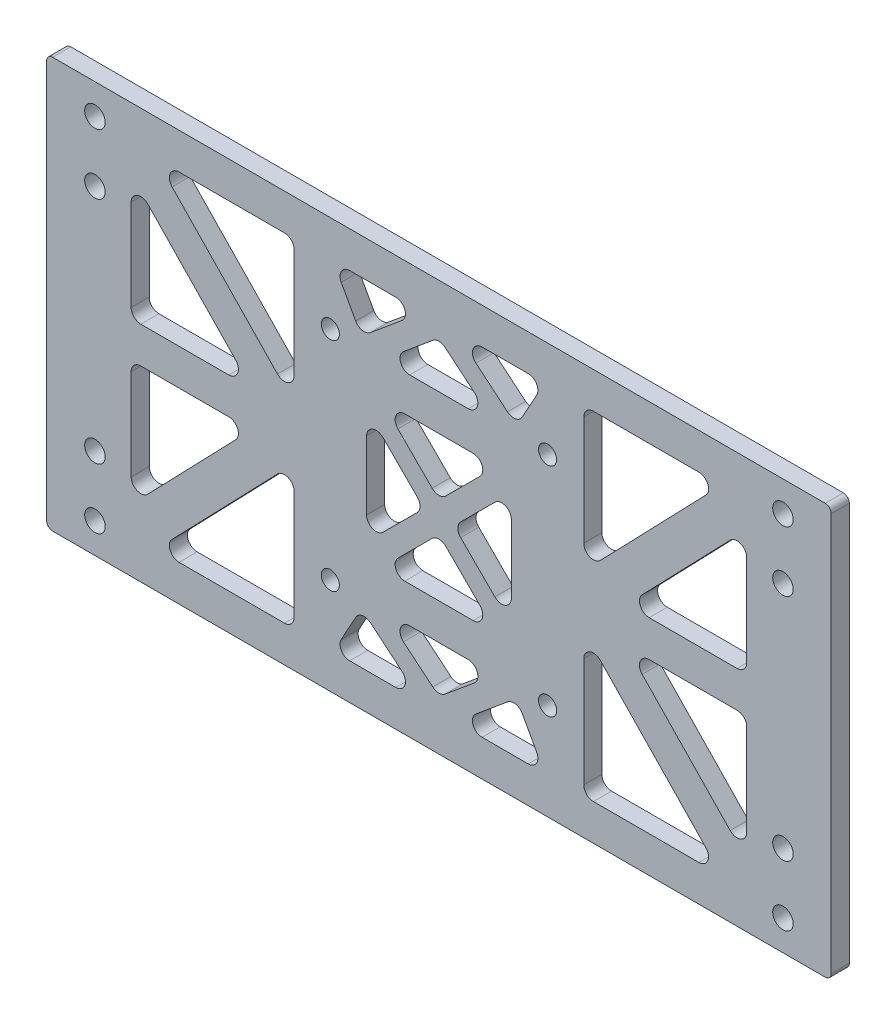
from build123d import *

# Parameters (mm, degrees)
SKETCH_1_W          = 130
SKETCH_1_H          = 68
EXTRUDE_1_DEPTH     = 3
SKETCH_2_R          = 1.7
CUT_EXTRUDE_1_DEPTH = 74.416619372
SKETCH_3_R          = 1.5
CUT_EXTRUDE_2_DEPTH = 74.416619372
SKETCH_4_W          = 27
SKETCH_4_H          = 56
SKETCH_4_W_2        = 24
SKETCH_4_H_2        = 24
CUT_EXTRUDE_3_DEPTH = 74.416619372
EXTRUDE_1_2_DEPTH   = 3
EXTRUDE_START       = -3
EXTRUDE_3_DEPTH     = 3
FILLET_2_R          = 1
FILLET_3_R          = 1.6


# Read off the part's stored shape, not the designer's step: 拉伸-薄壁3
with BuildPart() as part:
    # 草图1 → Extrude 1 (new body)
    with BuildSketch(Plane.XY):
        Rectangle(SKETCH_1_W, SKETCH_1_H)
    extrude(amount=EXTRUDE_1_DEPTH)

    # 草图2 → 切除-拉伸1 (cut, through all)
    with BuildSketch(Plane.XY.offset(3)):
        with Locations((-57, -29)):
            Circle(SKETCH_2_R)
        with Locations((-57, -19)):
            Circle(SKETCH_2_R)
        with Locations((-57, 19)):
            Circle(SKETCH_2_R)
        with Locations((-57, 29)):
            Circle(SKETCH_2_R)
        with Locations(Location((57, 29, 0), (0, 0, 180))):
            Circle(SKETCH_2_R)
        with Locations(Location((57, 19, 0), (0, 0, 180))):
            Circle(SKETCH_2_R)
        with Locations(Location((57, -19, 0), (0, 0, 180))):
            Circle(SKETCH_2_R)
        with Locations(Location((57, -29, 0), (0, 0, 180))):
            Circle(SKETCH_2_R)
    extrude(amount=-CUT_EXTRUDE_1_DEPTH, mode=Mode.SUBTRACT)

    # 草图3 → 切除-拉伸2 (cut, through all)
    with BuildSketch(Plane.XY.offset(3)):
        with Locations((-18, 18)):
            Circle(SKETCH_3_R)
        with Locations((18, 18)):
            Circle(SKETCH_3_R)
        with Locations((18, -18)):
            Circle(SKETCH_3_R)
        with Locations((-18, -18)):
            Circle(SKETCH_3_R)
    extrude(amount=-CUT_EXTRUDE_2_DEPTH, mode=Mode.SUBTRACT)

    # 草图4 → 切除-拉伸3 (cut, through all)
    with BuildSketch(Plane.XY.offset(3)):
        with Locations((-37.5, 0)):
            Rectangle(SKETCH_4_W, SKETCH_4_H)
        Rectangle(SKETCH_4_W_2, SKETCH_4_H_2)
        with Locations((37.5, 0)):
            Rectangle(SKETCH_4_W, SKETCH_4_H)
        Polygon((-17.5, 28), (-12, 18), (12, 18), (17.5, 28), align=None)
        Polygon((12, -18), (17.5, -28), (-17.5, -28), (-12, -18), align=None)
    extrude(amount=-CUT_EXTRUDE_3_DEPTH, mode=Mode.SUBTRACT)

    # 草图5 → Extrude 1 2 (add, through all)
    with BuildSketch(Plane.XY.offset(3)):
        Polygon((-13.237436867, 10.762563133), (10.762563133, -13.237436867), (13.237436867, -10.762563133), (-10.762563133, 13.237436867), align=None)
        Polygon((-10.762563133, -13.237436867), (13.237436867, 10.762563133), (10.762563133, 13.237436867), (-13.237436867, -10.762563133), align=None)
        Polygon((-10.879677301, 16.655612761), (0, 25.722010511), (10.879677301, 16.655612761), (13.120322699, 19.344387239), (0, 30.277989489), (-13.120322699, 19.344387239), align=None)
        Polygon((-13.120322699, -19.344387239), (0, -30.277989489), (13.120322699, -19.344387239), (10.879677301, -16.655612761), (0, -25.722010511), (-10.879677301, -16.655612761), align=None)
    extrude(amount=-EXTRUDE_1_2_DEPTH)

    # 拉伸-薄壁3 outline → 拉伸-薄壁3 (add)
    with BuildSketch(Plane.XY.offset(3).offset(EXTRUDE_START)):
        Polygon((51, -23.678077702), (31.060425073, -3), (51, -3), (51, 3), (31.060425073, 3), (51, 23.678077702), (51, 28), (46.83243207, 28), (24, 4.321922298), (24, -4.321922298), (46.83243207, -28), (51, -28), align=None)
        Polygon((-51, 23.678077702), (-31.060425073, 3), (-51, 3), (-51, -3), (-31.060425073, -3), (-51, -23.678077702), (-51, -28), (-46.83243207, -28), (-24, -4.321922298), (-24, 4.321922298), (-46.83243207, 28), (-51, 28), align=None)
    extrude(amount=EXTRUDE_3_DEPTH)

    # 圆角2
    fillet_2_edges = [part.edges().sort_by_distance(p)[0] for p in [
        (65, -34, 1.5),
        (-65, -34, 1.5),
        (-65, 34, 1.5),
        (65, 34, 1.5),
    ]]
    fillet(fillet_2_edges, radius=FILLET_2_R)

    # 圆角3
    fillet_3_edges = [part.edges().sort_by_distance(p)[0] for p in [
        (-24, 28, 1.5),
        (-24, -28, 1.5),
        (17.5, -28, 1.5),
        (-17.5, -28, 1.5),
        (-17.5, 28, 1.5),
        (17.5, 28, 1.5),
        (24, -28, 1.5),
        (24, 28, 1.5),
        (9.525126266, 12, 1.5),
        (-9.525126266, 12, 1.5),
        (-12, -9.525126266, 1.5),
        (-12, 9.525126266, 1.5),
        (-9.525126266, -12, 1.5),
        (9.525126266, -12, 1.5),
        (12, 9.525126266, 1.5),
        (12, -9.525126266, 1.5),
        (2.474873734, 0, 1.5),
        (0, -2.474873734, 1.5),
        (-2.474873734, 0, 1.5),
        (0, 2.474873734, 1.5),
        (-12.859127464, 19.562049935, 1.5),
        (-9.266412613, 18, 1.5),
        (9.266412613, 18, 1.5),
        (12.859127464, 19.562049935, 1.5),
        (2.733587387, 28, 1.5),
        (0, 25.722010511, 1.5),
        (-2.733587387, 28, 1.5),
        (-12.859127464, -19.562049935, 1.5),
        (2.733587387, -28, 1.5),
        (9.266412613, -18, 1.5),
        (-9.266412613, -18, 1.5),
        (0, -25.722010511, 1.5),
        (12.859127464, -19.562049935, 1.5),
        (-2.733587387, -28, 1.5),
        (46.83243207, 28, 1.5),
        (24, -4.321922298, 1.5),
        (51, 23.678077702, 1.5),
        (51, -23.678077702, 1.5),
        (31.060425073, -3, 1.5),
        (31.060425073, 3, 1.5),
        (46.83243207, -28, 1.5),
        (24, 4.321922298, 1.5),
        (51, 3, 1.5),
        (51, -3, 1.5),
        (-46.83243207, -28, 1.5),
        (-24, 4.321922298, 1.5),
        (-51, -23.678077702, 1.5),
        (-51, 23.678077702, 1.5),
        (-46.83243207, 28, 1.5),
        (-24, -4.321922298, 1.5),
        (-31.060425073, -3, 1.5),
        (-51, -3, 1.5),
        (-31.060425073, 3, 1.5),
        (-51, 3, 1.5),
    ]]
    fillet(fillet_3_edges, radius=FILLET_3_R)


solid = part.part
